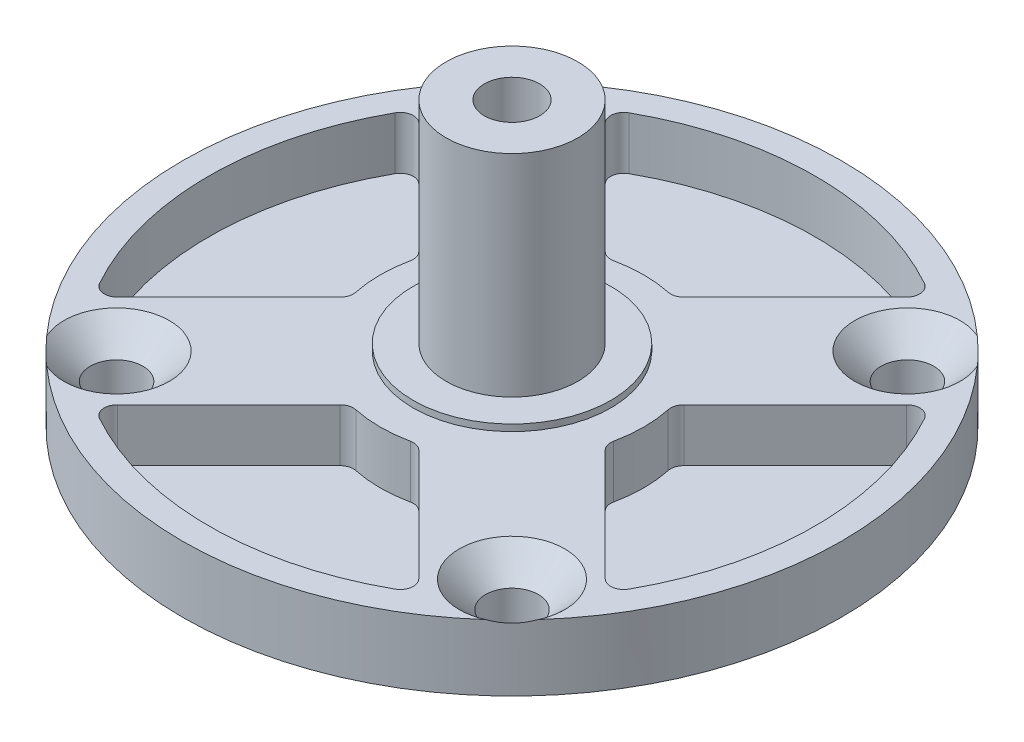
from build123d import *

# Parameters (mm, degrees)
SKETCH_1_R             = 25
EXTRUDE_1_DEPTH        = 5
SKETCH_3_R             = 7.5
EXTRUDE_2_DEPTH        = 0.5
SKETCH_4_R             = 5
EXTRUDE_3_DEPTH        = 16
SKETCH_8_R             = 2
CUT_EXTRUDE_2_DEPTH    = 42.379342672
CHAMFER_1_SIZE         = 2
CUT_EXTRUDE_5_DEPTH    = 4
FILLET_1_R             = 1
HOLE_WIZARD_M5_1_D     = 4.2
HOLE_WIZARD_M5_1_DEPTH = 12.4
HOLE_WIZARD_M5_1_TIP   = 1.2618073


with BuildPart() as part:
    # 草图1 → 凸台-拉伸1 (new body)
    with BuildSketch(Plane(origin=(0, 0, 0), x_dir=(1, 0, 0), z_dir=(0, 1, 0))):
        with Locations(Location((0, 0, 0), (0, 0, 270))):
            Circle(SKETCH_1_R)
    extrude(amount=EXTRUDE_1_DEPTH)

    # 草图3 → 凸台-拉伸2 (add)
    with BuildSketch(Plane(origin=(0, 5, 0), x_dir=(1, 0, 0), z_dir=(0, 1, 0))):
        with Locations(Location((0, 0, 0), (0, 0, 270))):
            Circle(SKETCH_3_R)
    extrude(amount=EXTRUDE_2_DEPTH)

    # 草图4 → 凸台-拉伸3 (add)
    with BuildSketch(Plane(origin=(0, 5.5, 0), x_dir=(1, 0, 0), z_dir=(0, 1, 0))):
        with Locations(Location((0, 0, 0), (0, 0, 270))):
            Circle(SKETCH_4_R)
    extrude(amount=EXTRUDE_3_DEPTH)

    # 草图8 → 切除-拉伸2 (cut, through all)
    with BuildSketch(Plane(origin=(0, 0, 0), x_dir=(-1, 0, 0), z_dir=(0, -1, 0))):
        with Locations(Location((-15, -15, 0), (0, 0, 90))):
            Circle(SKETCH_8_R)
        with Locations(Location((15, -15, 0), (0, 0, 90))):
            Circle(SKETCH_8_R)
        with Locations(Location((15, 15, 0), (0, 0, 90))):
            Circle(SKETCH_8_R)
        with Locations(Location((-15, 15, 0), (0, 0, 90))):
            Circle(SKETCH_8_R)
    extrude(amount=-CUT_EXTRUDE_2_DEPTH, mode=Mode.SUBTRACT)

    # 倒角1
    # the kernel refuses this chamfer: 2 mm, written as the material it takes off along each edge
    with BuildSketch(Plane(origin=(15, 5, -15), x_dir=(0, 0, -1), z_dir=(-1, 0, 0))) as chamfer_1_piece_1:
        Polygon((2 + CHAMFER_1_SIZE, 0), (2, CHAMFER_1_SIZE), (2, 0), align=None)
    revolve(axis=Axis((15, 5, -15), (0, -1, 0)), mode=Mode.SUBTRACT)
    with BuildSketch(Plane(origin=(-15, 5, -15), x_dir=(0, 0, -1), z_dir=(-1, 0, 0))) as chamfer_1_piece_2:
        Polygon((2 + CHAMFER_1_SIZE, 0), (2, CHAMFER_1_SIZE), (2, 0), align=None)
    revolve(axis=Axis((-15, 5, -15), (0, -1, 0)), mode=Mode.SUBTRACT)
    with BuildSketch(Plane(origin=(-15, 5, 15), x_dir=(0, 0, -1), z_dir=(-1, 0, 0))) as chamfer_1_piece_3:
        Polygon((2 + CHAMFER_1_SIZE, 0), (2, CHAMFER_1_SIZE), (2, 0), align=None)
    revolve(axis=Axis((-15, 5, 15), (0, -1, 0)), mode=Mode.SUBTRACT)
    with BuildSketch(Plane(origin=(15, 5, 15), x_dir=(0, 0, -1), z_dir=(-1, 0, 0))) as chamfer_1_piece_4:
        Polygon((2 + CHAMFER_1_SIZE, 0), (2, CHAMFER_1_SIZE), (2, 0), align=None)
    revolve(axis=Axis((15, 5, 15), (0, -1, 0)), mode=Mode.SUBTRACT)

    # 草图13 → 切除-拉伸5 (cut)
    with BuildSketch(Plane(origin=(0, 5, 0), x_dir=(1, 0, 0), z_dir=(0, 1, 0))):
        with BuildLine():
            Line((-12.33897396, 19.410041772), (-2.588190451, 9.659258263))
            ThreePointArc((-2.588190451, 9.659258263), (0, 10), (2.588190451, 9.659258263))
            Line((2.588190451, 9.659258263), (12.33897396, 19.410041772))
            ThreePointArc((12.33897396, 19.410041772), (0, 23), (-12.33897396, 19.410041772))
        make_face()
        with BuildLine():
            Line((19.410041772, -12.33897396), (9.659258263, -2.588190451))
            ThreePointArc((9.659258263, -2.588190451), (10, 0), (9.659258263, 2.588190451))
            Line((9.659258263, 2.588190451), (19.410041772, 12.33897396))
            ThreePointArc((19.410041772, 12.33897396), (23, 0), (19.410041772, -12.33897396))
        make_face()
        with BuildLine():
            Line((-12.33897396, -19.410041772), (-2.588190451, -9.659258263))
            ThreePointArc((-2.588190451, -9.659258263), (0, -10), (2.588190451, -9.659258263))
            Line((2.588190451, -9.659258263), (12.33897396, -19.410041772))
            ThreePointArc((12.33897396, -19.410041772), (0, -23), (-12.33897396, -19.410041772))
        make_face()
        with BuildLine():
            Line((-19.410041772, 12.33897396), (-9.659258263, 2.588190451))
            ThreePointArc((-9.659258263, 2.588190451), (-10, 0), (-9.659258263, -2.588190451))
            Line((-9.659258263, -2.588190451), (-19.410041772, -12.33897396))
            ThreePointArc((-19.410041772, -12.33897396), (-23, 0), (-19.410041772, 12.33897396))
        make_face()
    extrude(amount=-CUT_EXTRUDE_5_DEPTH, mode=Mode.SUBTRACT)

    # 圆角1
    fillet_1_edges = [part.edges().sort_by_distance(p)[0] for p in [
        (12.33897396, 3, 19.410041772),
        (-12.33897396, 3, 19.410041772),
        (-2.588190451, 3, 9.659258263),
        (2.588190451, 3, 9.659258263),
        (19.410041772, 3, -12.33897396),
        (19.410041772, 3, 12.33897396),
        (9.659258263, 3, 2.588190451),
        (9.659258263, 3, -2.588190451),
        (-19.410041772, 3, 12.33897396),
        (-19.410041772, 3, -12.33897396),
        (-9.659258263, 3, -2.588190451),
        (-9.659258263, 3, 2.588190451),
        (-12.33897396, 3, -19.410041772),
        (12.33897396, 3, -19.410041772),
        (2.588190451, 3, -9.659258263),
        (-2.588190451, 3, -9.659258263),
    ]]
    fillet(fillet_1_edges, radius=FILLET_1_R)

    # M5 螺纹孔1
    with Locations(Plane(origin=(0, 21.5, 0), x_dir=(1, 0, 0), z_dir=(0, 1, 0))):
        with Locations((0, 0)):
            Hole(HOLE_WIZARD_M5_1_D / 2, depth=HOLE_WIZARD_M5_1_DEPTH)
            with Locations((0, 0, -(HOLE_WIZARD_M5_1_DEPTH + HOLE_WIZARD_M5_1_TIP / 2))):  # 118° drill point
                Cone(0, HOLE_WIZARD_M5_1_D / 2, HOLE_WIZARD_M5_1_TIP, mode=Mode.SUBTRACT)


solid = part.part
